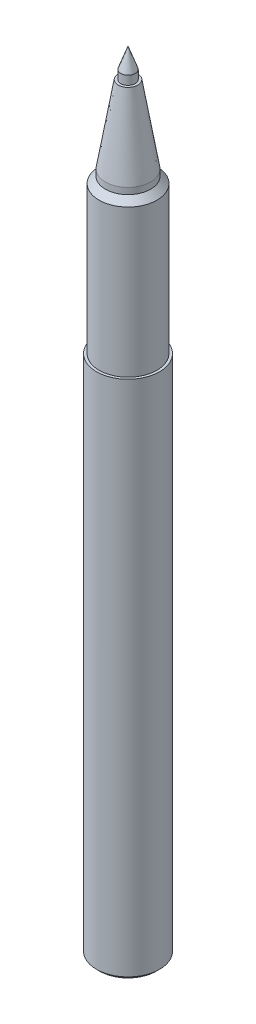
from build123d import *

# Parameters (mm, degrees)
CHAMFER_1_SIZE = 0.5


# Read off the part's stored shape, not the designer's step: 旋转1
with BuildPart() as part:
    # 旋转1 outline → 旋转1 (revolve)
    with BuildSketch(Plane.XY):
        Polygon((1.15, 111.197298964), (0, 114.397298964), (0, -10.602701036), (5, -10.602701036), (5, 72.097298964), (4.6, 72.097298964), (4.6, 95.497298964), (3.6, 96.497298964), (3.6, 97.497298964), (1.55, 109.797298964), (1.15, 109.797298964), align=None)
    revolve(axis=Axis((0, 0, 0), (0, 1, 0)))

    # 倒角1
    chamfer_1_edges = [part.edges().sort_by_distance(p)[0] for p in [
        (-5, -10.602701036, 0),
    ]]
    chamfer(chamfer_1_edges, length=CHAMFER_1_SIZE)


solid = part.part
